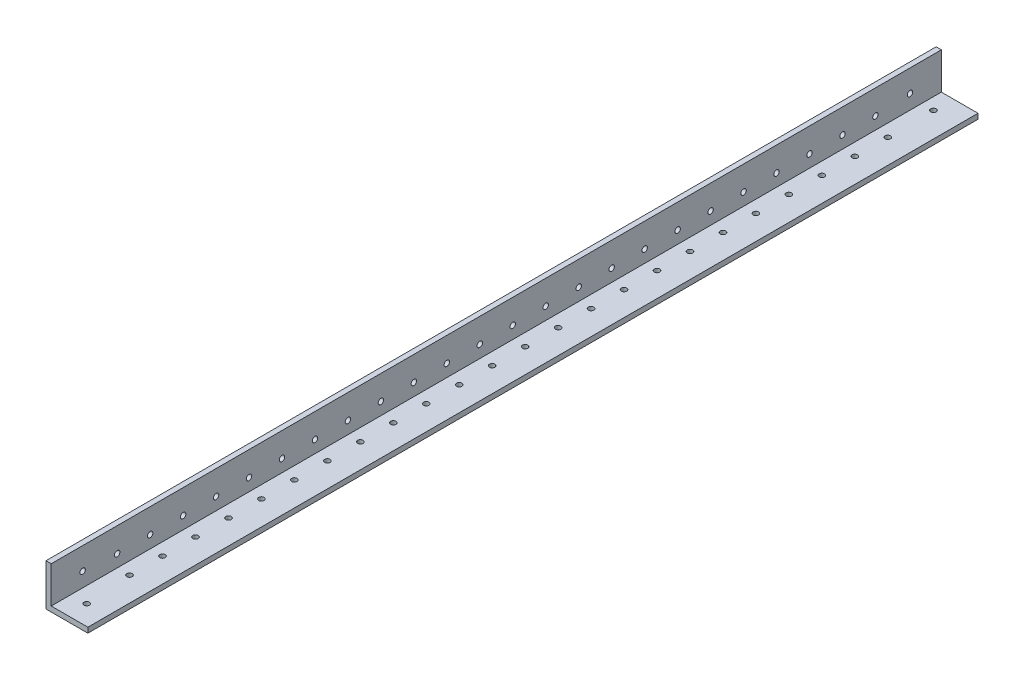
from build123d import *

# Parameters (mm, degrees)
BOSS_EXTRUDE1_DEPTH = 1219.2
FILLET1_R           = 0.4064
SKETCH4_W           = 1898.4
SKETCH4_H           = 103.278519729
CUT_EXTRUDE1_DEPTH  = 60
SKETCH5_W           = 2.47699065
SKETCH5_H           = 2.94685794
CUT_EXTRUDE2_DEPTH  = 600
SKETCH8_R           = 1.65
CUT_EXTRUDE4_DEPTH  = 20
SKETCH9_R           = 1.65
CUT_EXTRUDE5_DEPTH  = 20
SKETCH10_R          = 1.65
CUT_EXTRUDE6_DEPTH  = 70
SKETCH11_R          = 1.65
CUT_EXTRUDE7_DEPTH  = 70


with BuildPart() as part:
    # Sketch3 → Boss-Extrude1 (new, symmetric)
    with BuildSketch(Plane.XY):
        Polygon((3.175, 25.4), (0, 25.4), (0, 0), (25.4, 0), (25.4, 3.175), (3.175, 3.175), align=None)
    extrude(amount=BOSS_EXTRUDE1_DEPTH, both=True)

    # Fillet1
    fillet1_edges = [part.edges().sort_by_distance(p)[0] for p in [
        (3.175, 3.175, 0),
    ]]
    fillet(fillet1_edges, radius=FILLET1_R)

    # Sketch4 → Cut-Extrude1 (cut)
    with BuildSketch(Plane.ZY):
        with Locations((-270, -26.239259864)):
            Rectangle(SKETCH4_W, SKETCH4_H)
    extrude(amount=-CUT_EXTRUDE1_DEPTH, mode=Mode.SUBTRACT)

    # Sketch5 → Cut-Extrude2 (cut)
    with BuildSketch(Plane(origin=(0, 0, 679.2), x_dir=(-1, 0, 0), z_dir=(0, 0, -1))):
        with Locations((-4.413495325, 4.64842897)):
            Rectangle(SKETCH5_W, SKETCH5_H)
    extrude(amount=-CUT_EXTRUDE2_DEPTH, mode=Mode.SUBTRACT)

    # Sketch8 → Cut-Extrude4 (cut)
    with BuildSketch(Plane(origin=(3.175, 0, 0), x_dir=(0, 0, -1), z_dir=(1, 0, 0))):
        with Locations((-1179.2, 10.675)):
            Circle(SKETCH8_R)
        with Locations((-1159.2, 10.675)):
            Circle(SKETCH8_R)
        with Locations((-1139.2, 10.675)):
            Circle(SKETCH8_R)
        with Locations((-1119.2, 10.675)):
            Circle(SKETCH8_R)
        with Locations((-1099.2, 10.675)):
            Circle(SKETCH8_R)
        with Locations((-1079.2, 10.675)):
            Circle(SKETCH8_R)
        with Locations((-1059.2, 10.675)):
            Circle(SKETCH8_R)
        with Locations((-1039.2, 10.675)):
            Circle(SKETCH8_R)
        with Locations((-1019.2, 10.675)):
            Circle(SKETCH8_R)
        with Locations((-999.2, 10.675)):
            Circle(SKETCH8_R)
        with Locations((-979.2, 10.675)):
            Circle(SKETCH8_R)
        with Locations((-959.2, 10.675)):
            Circle(SKETCH8_R)
        with Locations((-939.2, 10.675)):
            Circle(SKETCH8_R)
        with Locations((-919.2, 10.675)):
            Circle(SKETCH8_R)
        with Locations((-899.2, 10.675)):
            Circle(SKETCH8_R)
        with Locations((-879.2, 10.675)):
            Circle(SKETCH8_R)
        with Locations((-859.2, 10.675)):
            Circle(SKETCH8_R)
        with Locations((-839.2, 10.675)):
            Circle(SKETCH8_R)
        with Locations((-819.2, 10.675)):
            Circle(SKETCH8_R)
        with Locations((-799.2, 10.675)):
            Circle(SKETCH8_R)
        with Locations((-779.2, 10.675)):
            Circle(SKETCH8_R)
        with Locations((-759.2, 10.675)):
            Circle(SKETCH8_R)
        with Locations((-739.2, 10.675)):
            Circle(SKETCH8_R)
        with Locations((-719.2, 10.675)):
            Circle(SKETCH8_R)
    extrude(amount=-CUT_EXTRUDE4_DEPTH, mode=Mode.SUBTRACT)

    # Sketch9 → Cut-Extrude5 (cut)
    with BuildSketch(Plane(origin=(0, 3.175, 0), x_dir=(1, 0, 0), z_dir=(0, 1, 0))):
        with Locations((10.675, -1179.2)):
            Circle(SKETCH9_R)
        with Locations((10.675, -1159.2)):
            Circle(SKETCH9_R)
        with Locations((10.675, -1139.2)):
            Circle(SKETCH9_R)
        with Locations((10.675, -1119.2)):
            Circle(SKETCH9_R)
        with Locations((10.675, -1099.2)):
            Circle(SKETCH9_R)
        with Locations((10.675, -1079.2)):
            Circle(SKETCH9_R)
        with Locations((10.675, -1059.2)):
            Circle(SKETCH9_R)
        with Locations((10.675, -1039.2)):
            Circle(SKETCH9_R)
        with Locations((10.675, -1019.2)):
            Circle(SKETCH9_R)
        with Locations((10.675, -999.2)):
            Circle(SKETCH9_R)
        with Locations((10.675, -979.2)):
            Circle(SKETCH9_R)
        with Locations((10.675, -959.2)):
            Circle(SKETCH9_R)
        with Locations((10.675, -939.2)):
            Circle(SKETCH9_R)
        with Locations((10.675, -919.2)):
            Circle(SKETCH9_R)
        with Locations((10.675, -899.2)):
            Circle(SKETCH9_R)
        with Locations((10.675, -879.2)):
            Circle(SKETCH9_R)
        with Locations((10.675, -859.2)):
            Circle(SKETCH9_R)
        with Locations((10.675, -839.2)):
            Circle(SKETCH9_R)
        with Locations((10.675, -819.2)):
            Circle(SKETCH9_R)
        with Locations((10.675, -799.2)):
            Circle(SKETCH9_R)
        with Locations((10.675, -779.2)):
            Circle(SKETCH9_R)
        with Locations((10.675, -759.2)):
            Circle(SKETCH9_R)
        with Locations((10.675, -739.2)):
            Circle(SKETCH9_R)
        with Locations((10.675, -719.2)):
            Circle(SKETCH9_R)
    extrude(amount=-CUT_EXTRUDE5_DEPTH, mode=Mode.SUBTRACT)

    # Sketch10 → Cut-Extrude6 (cut)
    with BuildSketch(Plane(origin=(3.175, 0, 0), x_dir=(0, 0, -1), z_dir=(1, 0, 0))):
        with Locations((-1200.15, 11.9634)):
            Circle(SKETCH10_R)
        with Locations((-698.25, 11.9634)):
            Circle(SKETCH10_R)
    extrude(amount=-CUT_EXTRUDE6_DEPTH, mode=Mode.SUBTRACT)

    # Sketch11 → Cut-Extrude7 (cut)
    with BuildSketch(Plane(origin=(0, 3.175, 0), x_dir=(1, 0, 0), z_dir=(0, 1, 0))):
        with Locations((10.364377143, -691.195704333)):
            Circle(SKETCH11_R)
        with Locations((12.7, -1207.204295667)):
            Circle(SKETCH11_R)
    extrude(amount=-CUT_EXTRUDE7_DEPTH, mode=Mode.SUBTRACT)


solid = part.part
